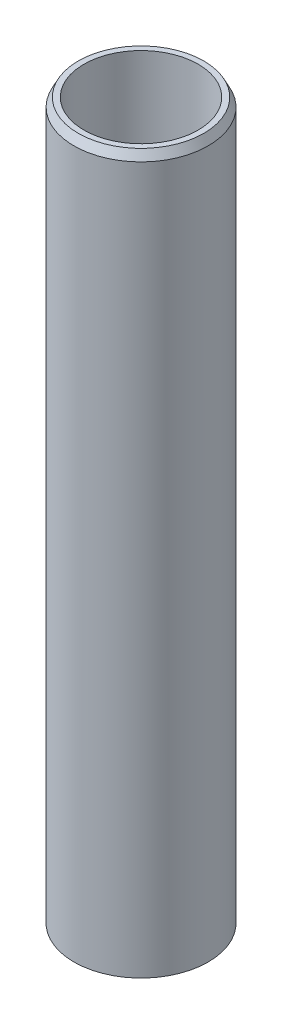
from build123d import *
from OCP.BRepFilletAPI import BRepFilletAPI_MakeChamfer

# Parameters (mm, degrees)
SKETCH1_R           = 45
BOSS_EXTRUDE1_DEPTH = 482.267406242
SKETCH2_R           = 38.264386141
CUT_EXTRUDE1_DEPTH  = 487.448199836
CHAMFER1_SIZE       = 5.774873353
CHAMFER1_SIZE2      = 2.957527457


with BuildPart() as part:
    # Sketch1 → Boss-Extrude1 (new body)
    with BuildSketch(Plane(origin=(0, 0, 0), x_dir=(1, 0, 0), z_dir=(0, 1, 0))):
        Circle(SKETCH1_R)
    extrude(amount=BOSS_EXTRUDE1_DEPTH)

    # Sketch2 → Cut-Extrude1 (cut, through all)
    with BuildSketch(Plane(origin=(0, 0, 0), x_dir=(1, 0, 0), z_dir=(0, 1, 0))):
        Circle(SKETCH2_R)
    extrude(amount=CUT_EXTRUDE1_DEPTH, mode=Mode.SUBTRACT)

    # Chamfer1: one chamfer whose edges measure the first distance from different faces: ONE call of the kernel's chamfer builder (chamfer() names one face for all edges)
    chamfer1_edges_1 = [part.edges().sort_by_distance(p)[0] for p in [
        (-45, 482.267406242, 0),
    ]]
    chamfer1_side_1 = [part.faces().sort_by_distance(p)[0] for p in [
        (-45, 241.133703121, 0),
    ]]
    chamfer1_edges_2 = [part.edges().sort_by_distance(p)[0] for p in [
        (-45, 0, 0),
    ]]
    chamfer1_side_2 = [part.faces().sort_by_distance(p)[0] for p in [
        (-43.727207794, 0, 0),
    ]]
    chamfer1 = BRepFilletAPI_MakeChamfer(part.part.solid().wrapped)
    for e in chamfer1_edges_1:
        chamfer1.Add(CHAMFER1_SIZE, CHAMFER1_SIZE2, e.wrapped, chamfer1_side_1[0].wrapped)  # the first distance lies on this face
    for e in chamfer1_edges_2:
        chamfer1.Add(CHAMFER1_SIZE, CHAMFER1_SIZE2, e.wrapped, chamfer1_side_2[0].wrapped)  # the first distance lies on this face
    add(Compound.cast(chamfer1.Shape()), mode=Mode.REPLACE)


solid = part.part
